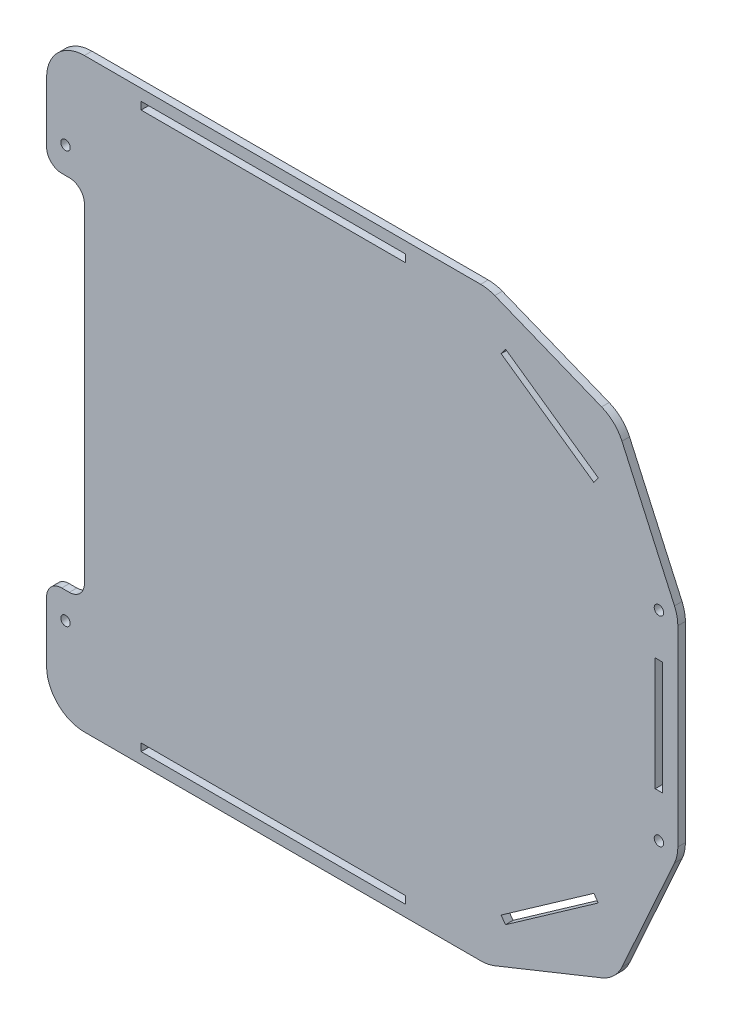
from build123d import *

# Parameters (mm, degrees)
ESTRUSIONE_ESTRUSIONE1_DEPTH = 2
FORO_FILETTATO_M3X0_5_1_D    = 2.5
SCHIZZO4_W                   = 70
SCHIZZO4_H                   = 2
TAGLIO_ESTRUSIONE1_DEPTH     = 10
FORO_FILETTATO_M3X0_5_2_D    = 2.5
SCHIZZO7_W                   = 2
SCHIZZO7_H                   = 30
TAGLIO_ESTRUSIONE2_DEPTH     = 10
SCHIZZO8_W                   = 10
SCHIZZO8_H                   = 95
TAGLIO_ESTRUSIONE3_DEPTH     = 10
RACCORDO1_R                  = 10
RACCORDO2_R                  = 10
RACCORDO3_R                  = 4


with BuildPart() as part:
    # Schizzo1 → Estrusione-Estrusione1 (new body)
    with BuildSketch(Plane.XY):
        Polygon((25.764676516, -77.5), (59.567435258, -63.90932479), (76, -27.5), (76, 27.5), (59.567435258, 63.90932479), (25.764676516, 77.5), (-91, 77.5), (-91, -77.5), align=None)
    extrude(amount=ESTRUSIONE_ESTRUSIONE1_DEPTH)

    # Foro filettato M3x0.5-1 (through all)
    with Locations(Plane(origin=(0, 0, 0), x_dir=(-1, 0, 0), z_dir=(0, 0, -1))):
        with Locations((86, -54.5), (86, 54.5)):
            Hole(FORO_FILETTATO_M3X0_5_1_D / 2)

    # Schizzo4 → Taglio-Estrusione1 (cut)
    with BuildSketch(Plane(origin=(0, 0, 0), x_dir=(-1, 0, 0), z_dir=(0, 0, -1))):
        with Locations((31, -73.5)):
            Rectangle(SCHIZZO4_W, SCHIZZO4_H)
        with Locations((31, 73.5)):
            Rectangle(SCHIZZO4_W, SCHIZZO4_H)
    extrude(amount=-TAGLIO_ESTRUSIONE1_DEPTH, mode=Mode.SUBTRACT)

    # Foro filettato M3x0.5-2 (through all)
    with Locations(Plane.XY.offset(2)):
        with Locations((71, 26.42393853), (71, -26.42393853)):
            Hole(FORO_FILETTATO_M3X0_5_2_D / 2)

    # Schizzo7 → Taglio-Estrusione2 (cut)
    with BuildSketch(Plane.XY.offset(2)):
        Polygon((30.400832321, 65.949521243), (54.947448301, 48.702386874), (53.797639343, 47.065945809), (29.251023363, 64.313080178), align=None)
        Polygon((53.797639343, -47.065945809), (29.251023363, -64.313080178), (30.400832321, -65.949521243), (54.947448301, -48.702386874), align=None)
        with Locations((71, 0)):
            Rectangle(SCHIZZO7_W, SCHIZZO7_H)
    extrude(amount=-TAGLIO_ESTRUSIONE2_DEPTH, mode=Mode.SUBTRACT)

    # Schizzo8 → Taglio-Estrusione3 (cut)
    with BuildSketch(Plane.XY.offset(2)):
        with Locations((-86, 0)):
            Rectangle(SCHIZZO8_W, SCHIZZO8_H)
    extrude(amount=-TAGLIO_ESTRUSIONE3_DEPTH, mode=Mode.SUBTRACT)

    # Raccordo1
    raccordo1_edges = [part.edges().sort_by_distance(p)[0] for p in [
        (-91, 77.5, 1),
        (-91, -77.5, 1),
    ]]
    fillet(raccordo1_edges, radius=RACCORDO1_R)

    # Raccordo2
    raccordo2_edges = [part.edges().sort_by_distance(p)[0] for p in [
        (25.764676516, -77.5, 1),
        (59.567435258, -63.90932479, 1),
        (76, -27.5, 1),
        (76, 27.5, 1),
        (59.567435258, 63.90932479, 1),
        (25.764676516, 77.5, 1),
    ]]
    fillet(raccordo2_edges, radius=RACCORDO2_R)

    # Raccordo3
    raccordo3_edges = [part.edges().sort_by_distance(p)[0] for p in [
        (-81, 47.5, 1),
        (-91, 47.5, 1),
        (-81, -47.5, 1),
        (-91, -47.5, 1),
    ]]
    fillet(raccordo3_edges, radius=RACCORDO3_R)


solid = part.part
